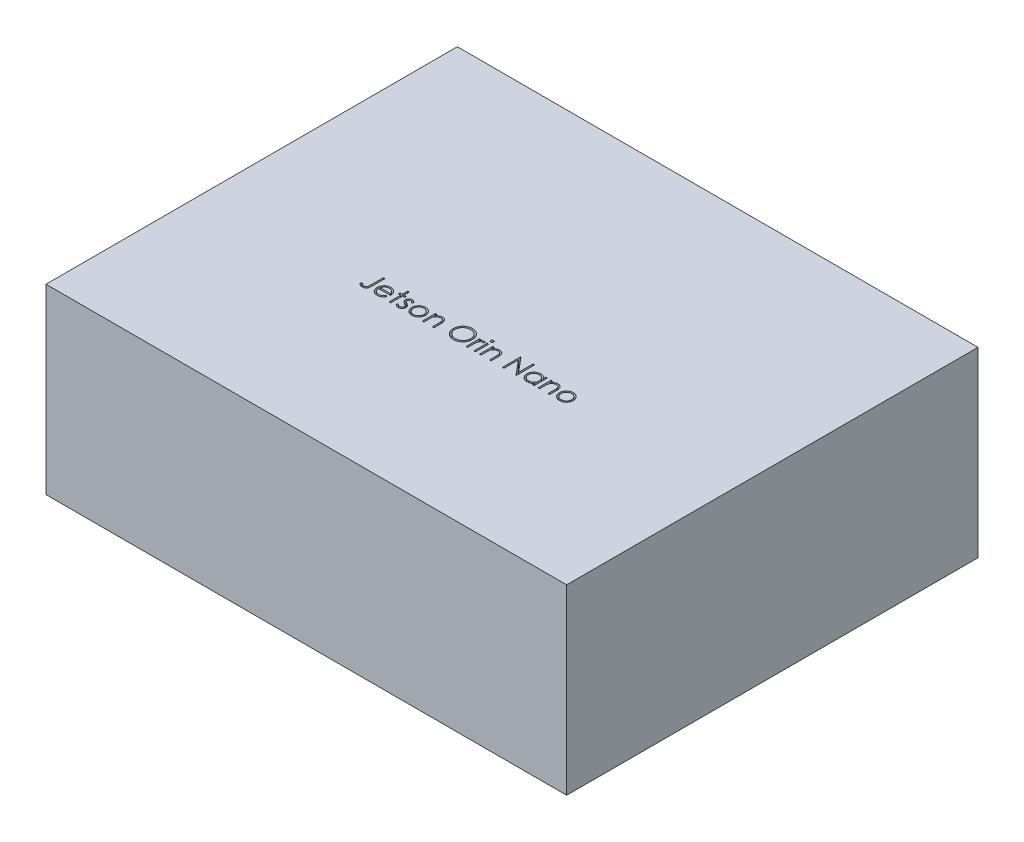
from build123d import *

# Parameters (mm, degrees)
SKETCH1_W           = 100
SKETCH1_H           = 79
BOSS_EXTRUDE1_DEPTH = 35
SKETCH2_W           = 0.314102564
SKETCH2_H           = 2.557692308
CUT_EXTRUDE1_DEPTH  = 5


with BuildPart() as part:
    # Sketch1 → Boss-Extrude1 (new body)
    with BuildSketch(Plane(origin=(0, 0, 0), x_dir=(1, 0, 0), z_dir=(0, 1, 0))):
        with Locations((50, 39.5)):
            Rectangle(SKETCH1_W, SKETCH1_H)
    extrude(amount=BOSS_EXTRUDE1_DEPTH)

    # Sketch2 → Cut-Extrude1 (cut)
    # profile 1 of 15: a face of its own
    with BuildSketch(Plane(origin=(0, 35, 0), x_dir=(1, 0, 0), z_dir=(0, 1, 0))):
        with BuildLine():
            Line((31.310897436, 33.5), (31.625, 33.5))
            Line((31.625, 33.5), (31.625, 31.136518429))
            add(Edge.make_bspline(
                [(31.625, 31.136518429), (31.624686081, 31.092813259), (31.624083319, 31.008893997), (31.620768909, 30.888020102), (31.614635431, 30.777649415), (31.605700418, 30.677530968), (31.593780186, 30.587978413), (31.580139157, 30.508299795), (31.563626359, 30.439160113), (31.538759892, 30.361524757), (31.497985944, 30.276380952), (31.436618906, 30.184425802), (31.360386109, 30.103992391), (31.272085076, 30.034139666), (31.170944052, 29.978482435), (31.059045833, 29.938527257), (30.937079245, 29.9141564), (30.852480033, 29.911582495), (30.808894231, 29.91025641)],
                knots=[0, 0, 0, 0, 1.237770943, 2.376671248, 3.424123796, 4.367912054, 5.222547132, 5.982086412, 6.656319012, 7.234008312, 8.288027371, 9.317870876, 10.352700517, 11.413286737, 12.494591526, 13.606319346, 14.766767577, 16, 16, 16, 16], degree=3))
            add(Edge.make_bspline(
                [(30.808894231, 29.91025641), (30.774935873, 29.911337019), (30.706609407, 29.913511277), (30.604918698, 29.93123299), (30.503516722, 29.958549033), (30.401865273, 29.998551628), (30.297956032, 30.052957227), (30.190381685, 30.124142043), (30.077758494, 30.21197357), (30.003575208, 30.279011315), (29.96474359, 30.314102564)],
                knots=[0, 0, 0, 0, 0.848567217, 1.707373443, 2.573483905, 3.470863513, 4.432650262, 5.500696352, 6.691726801, 8, 8, 8, 8], degree=3))
            Line((29.96474359, 30.314102564), (30.149839744, 30.583333333))
            add(Edge.make_bspline(
                [(30.149839744, 30.583333333), (30.192542423, 30.553885937), (30.273170649, 30.498285413), (30.39167509, 30.426758813), (30.496672243, 30.365433647), (30.56535519, 30.334181368), (30.597155449, 30.319711538)],
                knots=[0, 0, 0, 0, 1.196737151, 2.259595785, 3.194191475, 4, 4, 4, 4], degree=3))
            add(Edge.make_bspline(
                [(30.597155449, 30.319711538), (30.61643976, 30.312152081), (30.65426059, 30.297326302), (30.712085669, 30.280780404), (30.769580706, 30.271737994), (30.8076984, 30.270056661), (30.826422276, 30.269230769)],
                knots=[0, 0, 0, 0, 1.051806502, 2.062826769, 3.048436908, 4, 4, 4, 4], degree=3))
            add(Edge.make_bspline(
                [(30.826422276, 30.269230769), (30.850605064, 30.270253504), (30.89840552, 30.272275074), (30.967869514, 30.290124349), (31.034327546, 30.317368752), (31.095397203, 30.357260046), (31.15168259, 30.404691467), (31.198125416, 30.462047475), (31.23684266, 30.525613459), (31.260142354, 30.585784913), (31.274987126, 30.640661544), (31.284408753, 30.691094679), (31.292647413, 30.750056158), (31.299828965, 30.817616358), (31.304033435, 30.89391054), (31.308750708, 30.978714683), (31.310455969, 31.072242596), (31.31074579, 31.137453547), (31.310897436, 31.171574519)],
                knots=[0, 0, 0, 0, 0.997221856, 1.971139923, 2.944579524, 3.951425367, 4.971190333, 5.972282193, 6.985401279, 8.033996657, 8.624075553, 9.332086008, 10.151144245, 11.082816738, 12.137127781, 13.306538797, 14.590673636, 16, 16, 16, 16], degree=3))
            Line((31.310897436, 31.171574519), (31.310897436, 33.5))
        make_face()
    # profile 2 of 15: a face of its own
    with BuildSketch(Plane(origin=(0, 35, 0), x_dir=(1, 0, 0), z_dir=(0, 1, 0))):
        with BuildLine():
            Line((34.531850962, 30.807692308), (34.810897436, 30.661157853))
            add(Edge.make_bspline(
                [(34.810897436, 30.661157853), (34.788660841, 30.621714521), (34.745397232, 30.544973418), (34.670996484, 30.439541558), (34.593004412, 30.344693842), (34.507900444, 30.262964188), (34.418230765, 30.191712803), (34.32349811, 30.129374978), (34.223209292, 30.076256458), (34.117359567, 30.03150393), (34.005060016, 29.997094436), (33.8860385, 29.972790215), (33.760067005, 29.957766946), (33.673720825, 29.956021806), (33.629507212, 29.955128205)],
                knots=[0, 0, 0, 0, 1.120438281, 2.179929193, 3.190490725, 4.156257408, 5.095198341, 6.022838206, 6.959905092, 7.901321166, 8.864066838, 9.862729781, 10.905609505, 12, 12, 12, 12], degree=3))
            add(Edge.make_bspline(
                [(33.629507212, 29.955128205), (33.580365234, 29.95627538), (33.484503472, 29.958513187), (33.344963725, 29.977805652), (33.213584307, 30.00927801), (33.090372603, 30.053243552), (32.975630351, 30.110670876), (32.869129496, 30.180630358), (32.77030997, 30.262762612), (32.682285761, 30.357779056), (32.603041878, 30.459461013), (32.533116058, 30.565416898), (32.474658627, 30.675380122), (32.427106017, 30.788650646), (32.388701152, 30.90451454), (32.361934448, 31.024026007), (32.3465047, 31.146861592), (32.344140255, 31.229958927), (32.342948718, 31.271834936)],
                knots=[0, 0, 0, 0, 1.145258523, 2.234067595, 3.276747158, 4.290159414, 5.277019952, 6.260822364, 7.254936242, 8.264827045, 9.274100331, 10.257902744, 11.220704747, 12.172965371, 13.118907548, 14.062713208, 15.023725156, 16, 16, 16, 16], degree=3))
            add(Edge.make_bspline(
                [(32.342948718, 31.271834936), (32.344007859, 31.311129766), (32.346106938, 31.389006931), (32.359337725, 31.504272476), (32.382786018, 31.616300928), (32.414962342, 31.725185376), (32.456513588, 31.83074351), (32.507345807, 31.933039574), (32.567538185, 32.031964713), (32.614010859, 32.094367847), (32.637419872, 32.125801282)],
                knots=[0, 0, 0, 0, 1.024358464, 2.0301432, 3.019427413, 4.004406732, 4.986367066, 5.972626655, 6.978780325, 8, 8, 8, 8], degree=3))
            add(Edge.make_bspline(
                [(32.637419872, 32.125801282), (32.669127555, 32.163670152), (32.731538501, 32.238208303), (32.837094857, 32.336146628), (32.951395053, 32.418190404), (33.073006679, 32.48619754), (33.203343153, 32.537871187), (33.340652444, 32.576378769), (33.48649803, 32.59795678), (33.586203251, 32.601004614), (33.637219551, 32.602564103)],
                knots=[0, 0, 0, 0, 1.030682036, 2.02871468, 2.997146059, 3.962720338, 4.930598197, 5.918074684, 6.934738563, 8, 8, 8, 8], degree=3))
            add(Edge.make_bspline(
                [(33.637219551, 32.602564103), (33.689667157, 32.601210054), (33.792557403, 32.598553718), (33.942589524, 32.573927385), (34.08455024, 32.53487483), (34.218382744, 32.47972104), (34.344100605, 32.408561488), (34.460886655, 32.320419647), (34.570738167, 32.218001559), (34.634646746, 32.13923835), (34.667167468, 32.099158654)],
                knots=[0, 0, 0, 0, 1.056321875, 2.072262726, 3.055038591, 4.01806755, 4.982017516, 5.957941055, 6.960871419, 8, 8, 8, 8], degree=3))
            add(Edge.make_bspline(
                [(34.667167468, 32.099158654), (34.689294406, 32.068955072), (34.733400999, 32.008748954), (34.788648099, 31.910577797), (34.836605494, 31.807867202), (34.874938455, 31.698956905), (34.905977957, 31.585137325), (34.928434775, 31.46559478), (34.941604394, 31.340364869), (34.944193091, 31.255038314), (34.945512821, 31.211538462)],
                knots=[0, 0, 0, 0, 0.94817472, 1.890038105, 2.849395472, 3.817997239, 4.812318967, 5.836947057, 6.897266129, 8, 8, 8, 8], degree=3))
            Line((34.945512821, 31.211538462), (32.657051282, 31.211538462))
            add(Edge.make_bspline(
                [(32.657051282, 31.211538462), (32.658590888, 31.177837997), (32.661618462, 31.111567394), (32.675733606, 31.01459661), (32.697982379, 30.922223268), (32.729251442, 30.835140226), (32.767118287, 30.752210099), (32.813504004, 30.674048062), (32.868843558, 30.601010132), (32.930569257, 30.532442994), (32.999276353, 30.471382233), (33.0715591, 30.416730457), (33.148452665, 30.37092486), (33.229350748, 30.33374497), (33.314122534, 30.304638654), (33.402794729, 30.284770834), (33.495192845, 30.271463727), (33.558178579, 30.269984061), (33.590244391, 30.269230769)],
                knots=[0, 0, 0, 0, 1.094153842, 2.151609401, 3.174256925, 4.172055639, 5.149267565, 6.128595816, 7.11444997, 8.118368179, 9.117203808, 10.09244225, 11.054858984, 12.015122123, 12.976791628, 13.957293641, 14.960065497, 16, 16, 16, 16], degree=3))
            add(Edge.make_bspline(
                [(33.590244391, 30.269230769), (33.621595539, 30.269838826), (33.68380223, 30.271045327), (33.776443087, 30.282777238), (33.867582614, 30.301747513), (33.956843598, 30.327637504), (34.042414443, 30.359214356), (34.121659994, 30.397317213), (34.194540209, 30.43946696), (34.262657176, 30.487676635), (34.328728169, 30.546684822), (34.394270656, 30.620320543), (34.464547309, 30.707408071), (34.508536902, 30.772953737), (34.531850962, 30.807692308)],
                knots=[0, 0, 0, 0, 0.99110716, 1.966546729, 2.947904876, 3.932708344, 4.903319531, 5.828989031, 6.710028674, 7.56322171, 8.463672341, 9.504779593, 10.677557249, 12, 12, 12, 12], degree=3))
        make_face()
        with BuildLine():
            add(Edge.make_bspline(
                [(34.631410256, 31.525641026), (34.619913632, 31.567303899), (34.59778633, 31.64749152), (34.551549966, 31.75853241), (34.499478425, 31.857220311), (34.437856694, 31.942799944), (34.368037968, 32.018803457), (34.287392786, 32.085222043), (34.196956892, 32.144639494), (34.097197751, 32.194791993), (33.991555966, 32.237481852), (33.880949774, 32.266106968), (33.768091986, 32.28571651), (33.6917577, 32.287542618), (33.653345353, 32.288461538)],
                knots=[0, 0, 0, 0, 1.154881502, 2.222775134, 3.210006277, 4.132804581, 5.035138423, 5.962687519, 6.919655026, 7.923214229, 8.944639381, 9.960483929, 10.97369054, 12, 12, 12, 12], degree=3))
            add(Edge.make_bspline(
                [(33.653345353, 32.288461538), (33.621995914, 32.287849867), (33.560024665, 32.286640721), (33.468723597, 32.275170592), (33.381043898, 32.256210747), (33.29633861, 32.23024579), (33.215717742, 32.195637188), (33.137522974, 32.155053961), (33.063742577, 32.105512377), (33.017601282, 32.067753522), (32.994290865, 32.048677885)],
                knots=[0, 0, 0, 0, 1.04873581, 2.073130211, 3.073294108, 4.04793562, 5.032784715, 6.005352987, 6.992311501, 8, 8, 8, 8], degree=3))
            add(Edge.make_bspline(
                [(32.994290865, 32.048677885), (32.977597583, 32.033583569), (32.943814449, 32.003036353), (32.898673928, 31.950407146), (32.855453455, 31.893655584), (32.816119802, 31.83061046), (32.780042216, 31.761989681), (32.746282239, 31.688372045), (32.715895827, 31.609198915), (32.698799717, 31.554026476), (32.690004006, 31.525641026)],
                knots=[0, 0, 0, 0, 0.879870761, 1.780643979, 2.707998968, 3.669668524, 4.684282772, 5.740141944, 6.837334558, 8, 8, 8, 8], degree=3))
            Line((32.690004006, 31.525641026), (34.631410256, 31.525641026))
        make_face(mode=Mode.SUBTRACT)
    # profile 3 of 15: a face of its own
    with BuildSketch(Plane(origin=(0, 35, 0), x_dir=(1, 0, 0), z_dir=(0, 1, 0))):
        Polygon((35.887820513, 33.58974359), (36.201923077, 33.58974359), (36.201923077, 32.557692308), (36.650641026, 32.557692308), (36.650641026, 32.243589744), (36.201923077, 32.243589744), (36.201923077, 30), (35.887820513, 30), (35.887820513, 32.243589744), (35.439102564, 32.243589744), (35.439102564, 32.557692308), (35.887820513, 32.557692308), align=None)
    # profile 4 of 15: a face of its own
    with BuildSketch(Plane(origin=(0, 35, 0), x_dir=(1, 0, 0), z_dir=(0, 1, 0))):
        with BuildLine():
            Line((38.400641026, 32.238681891), (38.1875, 32.019230769))
            add(Edge.make_bspline(
                [(38.1875, 32.019230769), (38.169109496, 32.040543916), (38.133654771, 32.081633153), (38.07742329, 32.136570219), (38.021399686, 32.182707158), (37.966350873, 32.221659417), (37.910892603, 32.251108564), (37.855675685, 32.272603426), (37.800642947, 32.285905231), (37.763856912, 32.28761967), (37.745793269, 32.288461538)],
                knots=[0, 0, 0, 0, 1.26578478, 2.440284043, 3.530471711, 4.527705817, 5.468200915, 6.346673037, 7.188140097, 8, 8, 8, 8], degree=3))
            add(Edge.make_bspline(
                [(37.745793269, 32.288461538), (37.723653879, 32.287386665), (37.680086693, 32.285271468), (37.617660875, 32.264158037), (37.55971025, 32.231749299), (37.50955327, 32.185780715), (37.46706559, 32.133016446), (37.436051909, 32.074020122), (37.417085925, 32.010572078), (37.414681193, 31.96654222), (37.413461538, 31.944210737)],
                knots=[0, 0, 0, 0, 0.99966794, 1.967205029, 2.953328237, 3.988086729, 5.028030931, 6.008226631, 6.989793394, 8, 8, 8, 8], degree=3))
            add(Edge.make_bspline(
                [(37.413461538, 31.944210737), (37.414572351, 31.923998693), (37.416790844, 31.883631582), (37.434037523, 31.824083548), (37.461503595, 31.76602651), (37.48717379, 31.730463604), (37.500400641, 31.712139423)],
                knots=[0, 0, 0, 0, 0.960159726, 1.917612774, 2.927026955, 4, 4, 4, 4], degree=3))
            add(Edge.make_bspline(
                [(37.500400641, 31.712139423), (37.508364135, 31.702354839), (37.525313428, 31.681529584), (37.557121943, 31.652625731), (37.593144445, 31.62068348), (37.636464383, 31.588746643), (37.685215411, 31.555114918), (37.740454695, 31.521112785), (37.8004292, 31.48414836), (37.843366507, 31.460703924), (37.865685096, 31.448517628)],
                knots=[0, 0, 0, 0, 0.66740084, 1.420478572, 2.27185888, 3.217733974, 4.268547843, 5.408967954, 6.65319498, 8, 8, 8, 8], degree=3))
            add(Edge.make_bspline(
                [(37.865685096, 31.448517628), (37.892898673, 31.433272725), (37.945466343, 31.403824593), (38.020159111, 31.358114889), (38.087946152, 31.312683465), (38.149401819, 31.268016191), (38.203343628, 31.222863324), (38.251408181, 31.178955567), (38.292396625, 31.134966258), (38.315350551, 31.104233145), (38.326322115, 31.089543269)],
                knots=[0, 0, 0, 0, 1.27191281, 2.456916733, 3.569705269, 4.599008579, 5.553216877, 6.436649441, 7.252746552, 8, 8, 8, 8], degree=3))
            add(Edge.make_bspline(
                [(38.326322115, 31.089543269), (38.344532643, 31.059877181), (38.380774972, 31.00083616), (38.418833239, 30.903617733), (38.440893513, 30.80050723), (38.443955734, 30.72997501), (38.445512821, 30.694110577)],
                knots=[0, 0, 0, 0, 0.995354457, 1.980940102, 2.973342416, 4, 4, 4, 4], degree=3))
            add(Edge.make_bspline(
                [(38.445512821, 30.694110577), (38.444793287, 30.668841431), (38.443375367, 30.619045818), (38.4335173, 30.545710988), (38.416562323, 30.47557643), (38.393468569, 30.407881146), (38.362284197, 30.343922206), (38.325736399, 30.282085957), (38.281861488, 30.223710026), (38.231770112, 30.168871066), (38.176924618, 30.118785319), (38.11841848, 30.074761365), (38.056179649, 30.038187028), (37.990652848, 30.007921682), (37.921689194, 29.983853424), (37.849277904, 29.967190893), (37.77364915, 29.957218132), (37.722219342, 29.955833656), (37.696013622, 29.955128205)],
                knots=[0, 0, 0, 0, 1.032770009, 2.035186124, 3.017557409, 3.978232242, 4.952395191, 5.920591857, 6.910227898, 7.931268572, 8.952309245, 9.941945286, 10.918353717, 11.897095711, 12.887975737, 13.898235213, 14.929059601, 16, 16, 16, 16], degree=3))
            add(Edge.make_bspline(
                [(37.696013622, 29.955128205), (37.660646446, 29.956120905), (37.590403519, 29.958092513), (37.4865138, 29.976598574), (37.384993042, 30.005393968), (37.286609501, 30.045109902), (37.193563387, 30.095260615), (37.108432463, 30.155323008), (37.030921, 30.223313006), (36.986802727, 30.275425916), (36.96474359, 30.301482372)],
                knots=[0, 0, 0, 0, 1.013940152, 2.01379169, 3.017749504, 4.037548394, 5.051665909, 6.043208538, 7.021604269, 8, 8, 8, 8], degree=3))
            Line((36.96474359, 30.301482372), (37.172976763, 30.538461538))
            add(Edge.make_bspline(
                [(37.172976763, 30.538461538), (37.192749176, 30.517106774), (37.231080988, 30.475707334), (37.292382205, 30.420582993), (37.354761606, 30.374381722), (37.417596292, 30.335738307), (37.481816387, 30.305962904), (37.547062001, 30.28504431), (37.613200425, 30.271600118), (37.657622561, 30.270021836), (37.679887821, 30.269230769)],
                knots=[0, 0, 0, 0, 1.179806542, 2.287233372, 3.337373186, 4.324005949, 5.273901747, 6.200048787, 7.097828587, 8, 8, 8, 8], degree=3))
            add(Edge.make_bspline(
                [(37.679887821, 30.269230769), (37.710205746, 30.270601594), (37.769441888, 30.273279956), (37.854285647, 30.297597048), (37.932624273, 30.335727), (38.000647619, 30.389811698), (38.05854978, 30.452767271), (38.100477954, 30.52368139), (38.12675413, 30.600472847), (38.129840128, 30.653705149), (38.131410256, 30.680789263)],
                knots=[0, 0, 0, 0, 1.072336372, 2.095165389, 3.102688358, 4.141489647, 5.156069229, 6.117746104, 7.042326257, 8, 8, 8, 8], degree=3))
            add(Edge.make_bspline(
                [(38.131410256, 30.680789263), (38.130323962, 30.703098881), (38.128179219, 30.747146237), (38.111335947, 30.810896578), (38.084723095, 30.871365859), (38.058518447, 30.906755506), (38.045172276, 30.924779647)],
                knots=[0, 0, 0, 0, 1.013901739, 2.00181326, 2.98231254, 4, 4, 4, 4], degree=3))
            add(Edge.make_bspline(
                [(38.045172276, 30.924779647), (38.037149881, 30.93381501), (38.019674209, 30.953497292), (37.987618967, 30.98192237), (37.949237105, 31.01256047), (37.904096942, 31.044892059), (37.85210748, 31.078490664), (37.793058005, 31.113180016), (37.727757452, 31.150607742), (37.681586821, 31.175427397), (37.657451923, 31.188401442)],
                knots=[0, 0, 0, 0, 0.615000592, 1.339693406, 2.178160186, 3.116406724, 4.166410947, 5.330106347, 6.604359322, 8, 8, 8, 8], degree=3))
            add(Edge.make_bspline(
                [(37.657451923, 31.188401442), (37.631405283, 31.202940574), (37.580892536, 31.23113659), (37.509345245, 31.275052671), (37.44479789, 31.319719945), (37.385697316, 31.362632784), (37.33353631, 31.406053728), (37.288520362, 31.45003098), (37.248877146, 31.492790966), (37.226929734, 31.523088263), (37.216446314, 31.537560096)],
                knots=[0, 0, 0, 0, 1.262093308, 2.447601706, 3.550203992, 4.582594899, 5.537233252, 6.418365656, 7.244515135, 8, 8, 8, 8], degree=3))
            add(Edge.make_bspline(
                [(37.216446314, 31.537560096), (37.198315714, 31.566705711), (37.162048179, 31.625007126), (37.126832988, 31.722317603), (37.102626959, 31.824762661), (37.100464569, 31.895449515), (37.099358974, 31.931590545)],
                knots=[0, 0, 0, 0, 0.985009483, 1.970363186, 2.962279964, 4, 4, 4, 4], degree=3))
            add(Edge.make_bspline(
                [(37.099358974, 31.931590545), (37.09989317, 31.955215943), (37.100938666, 32.001454194), (37.109282717, 32.069393014), (37.124474428, 32.133941168), (37.143529351, 32.196068031), (37.170012355, 32.254570125), (37.201658261, 32.310227596), (37.238845685, 32.362963514), (37.281688976, 32.411966646), (37.328795622, 32.456475972), (37.379690391, 32.4952746), (37.433228648, 32.528380955), (37.489637067, 32.556146116), (37.54945754, 32.577147498), (37.612271927, 32.591604883), (37.677953082, 32.601260086), (37.722854208, 32.602123171), (37.745793269, 32.602564103)],
                knots=[0, 0, 0, 0, 1.087655834, 2.128696564, 3.144119009, 4.137814668, 5.115653402, 6.093965665, 7.082169637, 8.081268856, 9.086088321, 10.061021666, 11.022561449, 11.980240094, 12.950172527, 13.934149372, 14.944599409, 16, 16, 16, 16], degree=3))
            add(Edge.make_bspline(
                [(37.745793269, 32.602564103), (37.772985333, 32.601459762), (37.827879555, 32.599230364), (37.910234181, 32.581524674), (37.992467523, 32.552391569), (38.074790873, 32.512155336), (38.156601162, 32.46008846), (38.238618019, 32.397159161), (38.321826049, 32.323781446), (38.373782362, 32.267682221), (38.400641026, 32.238681891)],
                knots=[0, 0, 0, 0, 0.845714091, 1.707292901, 2.609013841, 3.555613372, 4.552488639, 5.621697636, 6.770543573, 8, 8, 8, 8], degree=3))
        make_face()
    # profile 5 of 15: a face of its own
    with BuildSketch(Plane(origin=(0, 35, 0), x_dir=(1, 0, 0), z_dir=(0, 1, 0))):
        with BuildLine():
            add(Edge.make_bspline(
                [(40.309094551, 32.602564103), (40.357085824, 32.601542211), (40.451184982, 32.599538533), (40.588992868, 32.578123567), (40.720538004, 32.545376203), (40.846324196, 32.500104641), (40.964740491, 32.43942269), (41.077511735, 32.367013399), (41.184328744, 32.281230805), (41.248351773, 32.214872737), (41.280849359, 32.181189904)],
                knots=[0, 0, 0, 0, 1.054011418, 2.066658804, 3.057071809, 4.030435133, 4.997543892, 5.974964718, 6.972108034, 8, 8, 8, 8], degree=3))
            add(Edge.make_bspline(
                [(41.280849359, 32.181189904), (41.308831313, 32.148975918), (41.364253693, 32.085171376), (41.435319412, 31.981715763), (41.496540972, 31.874575662), (41.545603933, 31.762328336), (41.584288957, 31.645953664), (41.611754653, 31.525051653), (41.628091588, 31.399889306), (41.630294555, 31.314885468), (41.631410256, 31.271834936)],
                knots=[0, 0, 0, 0, 1.025258237, 2.030674902, 3.01204498, 3.988269485, 4.97094183, 5.956517959, 6.965070386, 8, 8, 8, 8], degree=3))
            add(Edge.make_bspline(
                [(41.631410256, 31.271834936), (41.630428919, 31.228534878), (41.628489751, 31.142971945), (41.610146134, 31.016952579), (41.581615049, 30.894757756), (41.54078321, 30.776899063), (41.488425101, 30.663016235), (41.424534414, 30.553606686), (41.348662796, 30.448454553), (41.2626588, 30.348452714), (41.167606923, 30.2562865), (41.064490775, 30.17595823), (40.955336741, 30.107136706), (40.838693388, 30.05170029), (40.715625901, 30.00799059), (40.585868833, 29.977290573), (40.449623763, 29.95872889), (40.356596542, 29.956345316), (40.309094551, 29.955128205)],
                knots=[0, 0, 0, 0, 0.998656419, 1.973391657, 2.932242238, 3.890759089, 4.846373663, 5.82037756, 6.809684879, 7.83454468, 8.860553229, 9.859544525, 10.845671541, 11.83227036, 12.833544569, 13.85385346, 14.904124723, 16, 16, 16, 16], degree=3))
            add(Edge.make_bspline(
                [(40.309094551, 29.955128205), (40.261359832, 29.956349401), (40.167868972, 29.958741176), (40.03114299, 29.977218459), (39.901153371, 30.007976441), (39.777924773, 30.051843934), (39.660779926, 30.107138478), (39.550993429, 30.175750167), (39.447793513, 30.256310322), (39.352721529, 30.348446259), (39.266722924, 30.448456216), (39.190849915, 30.553606254), (39.126959589, 30.663016348), (39.074601385, 30.776899033), (39.033769572, 30.894757764), (39.00523848, 31.016952577), (38.986894865, 31.142971945), (38.984955696, 31.228534878), (38.983974359, 31.271834936)],
                knots=[0, 0, 0, 0, 1.099876186, 2.154163076, 3.173186993, 4.173200201, 5.163417411, 6.152872554, 7.150605724, 8.17532212, 9.198891216, 10.186952605, 11.159729845, 12.11414092, 13.071450619, 14.029093627, 15.002601286, 16, 16, 16, 16], degree=3))
            add(Edge.make_bspline(
                [(38.983974359, 31.271834936), (38.985097669, 31.314651482), (38.987321631, 31.399420884), (39.00364214, 31.524347945), (39.031000696, 31.645045334), (39.069732093, 31.76097081), (39.119247284, 31.872726246), (39.179608572, 31.980131077), (39.251399204, 32.083118877), (39.306601156, 32.146840957), (39.334535256, 32.179086538)],
                knots=[0, 0, 0, 0, 1.031353054, 2.041901799, 3.029428768, 4.008703097, 4.981709435, 5.96992636, 6.972712378, 8, 8, 8, 8], degree=3))
            add(Edge.make_bspline(
                [(39.334535256, 32.179086538), (39.366983847, 32.213061478), (39.430799711, 32.279879174), (39.538148439, 32.365411698), (39.65064226, 32.439327772), (39.770367186, 32.498803987), (39.896050044, 32.545642505), (40.028269287, 32.57820802), (40.166544802, 32.599461375), (40.261104423, 32.601519553), (40.309094551, 32.602564103)],
                knots=[0, 0, 0, 0, 1.027980169, 2.021703884, 2.998553061, 3.971491411, 4.943284454, 5.930300938, 6.949603206, 8, 8, 8, 8], degree=3))
        make_face()
        with BuildLine():
            add(Edge.make_bspline(
                [(40.307692308, 32.288461538), (40.273754696, 32.287496947), (40.206755568, 32.285592664), (40.108135983, 32.27110876), (40.013195829, 32.248161255), (39.921754985, 32.215557199), (39.834121813, 32.1734583), (39.75021241, 32.12174994), (39.66977997, 32.061116984), (39.594397907, 31.991654312), (39.525215595, 31.915775317), (39.464737618, 31.834926959), (39.413312512, 31.750420612), (39.370472353, 31.662168401), (39.338565165, 31.569275987), (39.315392142, 31.472795356), (39.300921902, 31.37252994), (39.299035523, 31.304368921), (39.298076923, 31.269731571)],
                knots=[0, 0, 0, 0, 1.021534396, 2.016698045, 2.994645724, 3.958388632, 4.93408049, 5.916473867, 6.921342795, 7.962252576, 8.998418191, 10.008913653, 10.997312074, 11.973003931, 12.956656626, 13.948281152, 14.957379055, 16, 16, 16, 16], degree=3))
            add(Edge.make_bspline(
                [(39.298076923, 31.269731571), (39.299683747, 31.224979543), (39.302872991, 31.136155138), (39.328808228, 31.005344015), (39.372194507, 30.879762163), (39.430781787, 30.760145777), (39.504188006, 30.649473499), (39.590675073, 30.550802015), (39.689314773, 30.465616203), (39.798931273, 30.394935358), (39.917285591, 30.338775602), (40.042541912, 30.298976626), (40.173182606, 30.273104934), (40.262463337, 30.270533459), (40.307692308, 30.269230769)],
                knots=[0, 0, 0, 0, 1.016792936, 2.018143844, 3.017858371, 4.030088057, 5.03801393, 6.028138512, 7.003788237, 7.991172063, 8.984598303, 9.972568034, 10.972917682, 12, 12, 12, 12], degree=3))
            add(Edge.make_bspline(
                [(40.307692308, 30.269230769), (40.352918677, 30.270541049), (40.442194273, 30.273127506), (40.572653449, 30.298846326), (40.697567421, 30.338949987), (40.815798809, 30.394872197), (40.925365412, 30.465884611), (41.024714534, 30.550320988), (41.110463145, 30.64973484), (41.18379675, 30.760292369), (41.243343492, 30.879576721), (41.286526694, 31.005367193), (41.31252428, 31.136149235), (41.315705109, 31.224977566), (41.317307692, 31.269731571)],
                knots=[0, 0, 0, 0, 1.02726834, 2.027799167, 3.010890988, 4.004497153, 4.992059811, 5.971914811, 6.958719428, 7.966827853, 8.981595046, 9.981490638, 10.983022906, 12, 12, 12, 12], degree=3))
            add(Edge.make_bspline(
                [(41.317307692, 31.269731571), (41.316349422, 31.304369128), (41.314463693, 31.372530554), (41.299988729, 31.472793007), (41.276833189, 31.569284604), (41.244861572, 31.662136607), (41.202207558, 31.750649112), (41.149790765, 31.834678839), (41.08955974, 31.916055385), (41.019542619, 31.991409026), (40.944239241, 32.061144062), (40.863774203, 32.121773452), (40.779989224, 32.173231047), (40.692610641, 32.215917288), (40.601158074, 32.247864628), (40.506350944, 32.271241259), (40.408152135, 32.285531456), (40.341393091, 32.287478598), (40.307692308, 32.288461538)],
                knots=[0, 0, 0, 0, 1.042956736, 2.052379634, 3.044323526, 4.02829302, 5.004299113, 5.996692471, 7.007513377, 8.048758398, 9.090003419, 10.095195979, 11.07790575, 12.047570684, 13.018257071, 13.989683339, 14.985167495, 16, 16, 16, 16], degree=3))
        make_face(mode=Mode.SUBTRACT)
    # profile 6 of 15: a face of its own
    with BuildSketch(Plane(origin=(0, 35, 0), x_dir=(1, 0, 0), z_dir=(0, 1, 0))):
        with BuildLine():
            Line((42.259615385, 32.557692308), (42.573717949, 32.557692308))
            Line((42.573717949, 32.557692308), (42.573717949, 32.096354167))
            add(Edge.make_bspline(
                [(42.573717949, 32.096354167), (42.607255584, 32.13819689), (42.672336535, 32.219394153), (42.780720868, 32.326114728), (42.895264768, 32.414059953), (43.015266772, 32.484163747), (43.140889782, 32.537010373), (43.271368052, 32.575176304), (43.407482758, 32.598061132), (43.500047195, 32.601051363), (43.546875, 32.602564103)],
                knots=[0, 0, 0, 0, 1.12780773, 2.188550248, 3.19190651, 4.159438251, 5.104880172, 6.052711206, 7.014878035, 8, 8, 8, 8], degree=3))
            add(Edge.make_bspline(
                [(43.546875, 32.602564103), (43.594205634, 32.600818907), (43.686843102, 32.597403139), (43.821721163, 32.570386448), (43.947694557, 32.524241192), (44.064314113, 32.461029122), (44.169441326, 32.382422649), (44.261766178, 32.290844867), (44.338129425, 32.185508784), (44.389326788, 32.087785627), (44.423052436, 32.001096833), (44.444284773, 31.926850083), (44.462315755, 31.844131932), (44.477947503, 31.753192343), (44.488524615, 31.653394153), (44.496866906, 31.545146461), (44.5028456, 31.42848433), (44.503082807, 31.347797703), (44.503205128, 31.306189904)],
                knots=[0, 0, 0, 0, 1.235846778, 2.418850247, 3.575807741, 4.728682307, 5.871620074, 6.994088408, 8.11269785, 9.256955736, 9.865816715, 10.540099792, 11.271859618, 12.076849838, 12.949306005, 13.892391288, 14.913166135, 16, 16, 16, 16], degree=3))
            Line((44.503205128, 31.306189904), (44.503205128, 30))
            Line((44.503205128, 30), (44.189102564, 30))
            Line((44.189102564, 30), (44.189102564, 31.203125))
            add(Edge.make_bspline(
                [(44.189102564, 31.203125), (44.188909356, 31.237947445), (44.188539782, 31.304556856), (44.187374135, 31.399925879), (44.184564329, 31.486412457), (44.180616016, 31.563809825), (44.174836985, 31.632043661), (44.168814354, 31.691252938), (44.161449377, 31.74136248), (44.154886464, 31.771527563), (44.151943109, 31.78505609)],
                knots=[0, 0, 0, 0, 1.430800155, 2.736877192, 3.918605307, 4.986035426, 5.920637409, 6.731861385, 7.431261377, 8, 8, 8, 8], degree=3))
            add(Edge.make_bspline(
                [(44.151943109, 31.78505609), (44.141317577, 31.824767275), (44.120866717, 31.901199019), (44.070332734, 32.004873372), (44.006518553, 32.09307156), (43.928620704, 32.165248281), (43.837391628, 32.221419118), (43.733084485, 32.260393073), (43.616705844, 32.284769342), (43.534851462, 32.287196474), (43.4921875, 32.288461538)],
                knots=[0, 0, 0, 0, 1.084156227, 2.086665306, 3.027808233, 3.945421172, 4.874247719, 5.839848303, 6.874090471, 8, 8, 8, 8], degree=3))
            add(Edge.make_bspline(
                [(43.4921875, 32.288461538), (43.466919816, 32.287985534), (43.416915723, 32.287043533), (43.342765751, 32.277592235), (43.270841578, 32.262133779), (43.200421369, 32.241265142), (43.132913576, 32.212602873), (43.066149284, 32.180073502), (43.00264252, 32.13952529), (42.941039123, 32.094334669), (42.883726315, 32.044255462), (42.830397977, 31.991410952), (42.782859957, 31.935135348), (42.739791282, 31.8763354), (42.702613018, 31.814203562), (42.67015993, 31.749339256), (42.642624235, 31.681657107), (42.628941543, 31.634682046), (42.622095353, 31.611177885)],
                knots=[0, 0, 0, 0, 1.023777757, 2.026029729, 3.023749952, 4.003683103, 4.997618607, 5.993177895, 7.010360494, 8.046726602, 9.087585522, 10.09234134, 11.086953743, 12.070360549, 13.043493632, 14.017870808, 15.008233677, 16, 16, 16, 16], degree=3))
            add(Edge.make_bspline(
                [(42.622095353, 31.611177885), (42.618155704, 31.593922682), (42.609579295, 31.556359007), (42.600316115, 31.494714588), (42.59190854, 31.423404613), (42.584871581, 31.342512296), (42.580566165, 31.251754421), (42.575871768, 31.151518583), (42.574162707, 31.041405094), (42.573870353, 30.964743402), (42.573717949, 30.924779647)],
                knots=[0, 0, 0, 0, 0.615963638, 1.340920617, 2.168419149, 3.115676021, 4.16674242, 5.331190069, 6.6087489, 8, 8, 8, 8], degree=3))
            Line((42.573717949, 30.924779647), (42.573717949, 30))
            Line((42.573717949, 30), (42.259615385, 30))
            Line((42.259615385, 30), (42.259615385, 32.557692308))
        make_face()
    # profile 7 of 15: a face of its own
    with BuildSketch(Plane(origin=(0, 35, 0), x_dir=(1, 0, 0), z_dir=(0, 1, 0))):
        with BuildLine():
            add(Edge.make_bspline(
                [(48.294871795, 33.58974359), (48.359679901, 33.58810211), (48.486968368, 33.584878109), (48.674043265, 33.560199006), (48.852638361, 33.517503616), (49.0242085, 33.460640633), (49.186701476, 33.384786248), (49.341340369, 33.2931011), (49.487757242, 33.184624641), (49.623978624, 33.060195414), (49.748635574, 32.92481196), (49.858461461, 32.78033405), (49.950503754, 32.627635248), (50.026089541, 32.467174417), (50.085388151, 32.299314449), (50.126307195, 32.123160446), (50.152445345, 31.939853756), (50.155501122, 31.814826892), (50.157051282, 31.751402244)],
                knots=[0, 0, 0, 0, 1.065120563, 2.091984664, 3.0946048, 4.079830382, 5.057816894, 6.036188127, 7.030412546, 8.04752943, 9.064399622, 10.05169764, 11.02544977, 11.989514704, 12.962713494, 13.945757189, 14.957906945, 16, 16, 16, 16], degree=3))
            add(Edge.make_bspline(
                [(50.157051282, 31.751402244), (50.15550135, 31.688444797), (50.152446253, 31.564348377), (50.126277475, 31.382204933), (50.085236475, 31.207114236), (50.026640209, 31.039368583), (49.951414731, 30.87879102), (49.85875956, 30.725804066), (49.749618349, 30.580357567), (49.625411498, 30.444044902), (49.490010456, 30.319047431), (49.344780189, 30.210128556), (49.192986869, 30.116404431), (49.032677161, 30.041620757), (48.865977124, 29.981848837), (48.691394801, 29.941096207), (48.509748247, 29.914809163), (48.385877243, 29.911790647), (48.322916667, 29.91025641)],
                knots=[0, 0, 0, 0, 1.043624062, 2.057103931, 3.04512605, 4.022047818, 4.998200453, 5.980619268, 6.982898556, 8.009068085, 9.034988726, 10.034168286, 11.015286542, 11.987931943, 12.962482838, 13.94673481, 14.956375938, 16, 16, 16, 16], degree=3))
            add(Edge.make_bspline(
                [(48.322916667, 29.91025641), (48.259492348, 29.911805797), (48.134466132, 29.914860051), (47.950929096, 29.941041456), (47.774651353, 29.98198276), (47.606137001, 30.040492196), (47.445292072, 30.116109427), (47.291801989, 30.208313806), (47.146282842, 30.317720947), (47.009941095, 30.441887521), (46.885191897, 30.577059073), (46.776432521, 30.721893329), (46.684207408, 30.873548785), (46.608844076, 31.032446309), (46.549179616, 31.197817752), (46.508474798, 31.370766229), (46.482138846, 31.550305735), (46.479104, 31.672548634), (46.477564103, 31.734575321)],
                knots=[0, 0, 0, 0, 1.053102029, 2.075944431, 3.073151272, 4.055350789, 5.033113405, 6.020478099, 7.024410459, 8.052272461, 9.079885166, 10.07527673, 11.055994387, 12.023226415, 12.992069828, 13.970394897, 14.97016774, 16, 16, 16, 16], degree=3))
            add(Edge.make_bspline(
                [(46.477564103, 31.734575321), (46.478098738, 31.77620799), (46.479161264, 31.858948113), (46.491952957, 31.981814713), (46.510514658, 32.102705371), (46.537116571, 32.221276319), (46.571908238, 32.337237304), (46.612960265, 32.451388067), (46.66310011, 32.56257179), (46.719780758, 32.671315182), (46.783042566, 32.775923088), (46.852918316, 32.874802671), (46.926953684, 32.968783668), (47.008117078, 33.055430672), (47.093733523, 33.137264328), (47.185191901, 33.213027045), (47.281934146, 33.283401996), (47.384376525, 33.346822337), (47.4899948, 33.404181472), (47.598871578, 33.453403323), (47.70952815, 33.495649384), (47.822482798, 33.529890209), (47.93743557, 33.556922245), (48.054637354, 33.575329599), (48.17399478, 33.588153917), (48.254406099, 33.589211419), (48.294871795, 33.58974359)],
                knots=[0, 0, 0, 0, 1.037015668, 2.060948919, 3.074880161, 4.083647147, 5.086022904, 6.090072063, 7.104153813, 8.122640571, 9.144368836, 10.147691507, 11.138137339, 12.123020368, 13.103399296, 14.087645067, 15.080126199, 16.082011238, 17.087798457, 18.072939717, 19.057185487, 20.037253025, 21.01195951, 21.997135196, 22.992090687, 24, 24, 24, 24], degree=3))
        make_face()
        with BuildLine():
            add(Edge.make_bspline(
                [(48.310296474, 33.230769231), (48.277081841, 33.230364341), (48.210970108, 33.229558431), (48.112685572, 33.218942715), (48.015693638, 33.203812826), (47.919974276, 33.182231305), (47.825927986, 33.152827253), (47.732678145, 33.118986345), (47.641075091, 33.077765254), (47.551421233, 33.03119255), (47.464506158, 32.979643629), (47.382493457, 32.922671862), (47.305170813, 32.861613307), (47.232727546, 32.79632547), (47.165376374, 32.726475868), (47.101791673, 32.653123432), (47.044522091, 32.574171541), (46.992036514, 32.491761134), (46.945068674, 32.405999553), (46.903303319, 32.317789691), (46.86913931, 32.226412004), (46.841276934, 32.132857846), (46.818177123, 32.037275387), (46.803543199, 31.938939538), (46.79281084, 31.838344426), (46.792050994, 31.770362572), (46.791666667, 31.735977564)],
                knots=[0, 0, 0, 0, 1.008559885, 2.007477868, 2.99961109, 3.989939068, 4.984837346, 5.991145699, 7.001802488, 8.033829008, 9.059044045, 10.069351652, 11.065060232, 12.050310815, 13.029377138, 14.011219647, 14.996725999, 15.989392538, 16.977580475, 17.965360261, 18.951710183, 19.937753436, 20.929683414, 21.935841486, 22.955955122, 24, 24, 24, 24], degree=3))
            add(Edge.make_bspline(
                [(46.791666667, 31.735977564), (46.792941529, 31.685415343), (46.795449576, 31.585943813), (46.817407147, 31.440175669), (46.851229121, 31.300087383), (46.901086487, 31.166445474), (46.963437102, 31.038101191), (47.040463992, 30.916193086), (47.131723078, 30.800688212), (47.235386605, 30.692392943), (47.348709311, 30.593547138), (47.469042041, 30.50678373), (47.595095649, 30.43337348), (47.727198851, 30.373568408), (47.86464639, 30.32617867), (48.008323941, 30.293700039), (48.157274401, 30.272324583), (48.258805056, 30.270271827), (48.310296474, 30.269230769)],
                knots=[0, 0, 0, 0, 1.032063989, 2.030389145, 3.003944642, 3.970395727, 4.937377036, 5.913328081, 6.909231446, 7.93887556, 8.970685674, 9.976071282, 10.964166581, 11.944589148, 12.933237628, 13.927779006, 14.949070134, 16, 16, 16, 16], degree=3))
            add(Edge.make_bspline(
                [(48.310296474, 30.269230769), (48.344905976, 30.269706274), (48.413547012, 30.270649342), (48.515642535, 30.280148018), (48.615898746, 30.295379888), (48.714175026, 30.317310543), (48.810359838, 30.34475775), (48.904854641, 30.377365478), (48.996652931, 30.418046682), (49.086912769, 30.462994633), (49.173309011, 30.514234791), (49.255784543, 30.56927294), (49.332260523, 30.630241561), (49.404649594, 30.694559374), (49.472277283, 30.763523221), (49.534686267, 30.837043443), (49.5916664, 30.9155841), (49.644132046, 30.997869506), (49.690935309, 31.083865759), (49.731714408, 31.172395437), (49.766310524, 31.263240546), (49.794239029, 31.356532118), (49.81612449, 31.452092966), (49.83120441, 31.550051045), (49.841752849, 31.650210387), (49.842547926, 31.717954243), (49.842948718, 31.752103365)],
                knots=[0, 0, 0, 0, 1.047197238, 2.076906641, 3.100256066, 4.114471768, 5.12198147, 6.126382909, 7.136867548, 8.15857795, 9.17633901, 10.174870724, 11.156907918, 12.133735059, 13.104061851, 14.077631395, 15.04955518, 16.038496417, 17.029181396, 18.010275684, 18.986308667, 19.968651475, 20.955262928, 21.950658345, 22.966943676, 24, 24, 24, 24], degree=3))
            add(Edge.make_bspline(
                [(49.842948718, 31.752103365), (49.842547605, 31.78601887), (49.841751923, 31.85329652), (49.831209449, 31.952757338), (49.816108558, 32.05001055), (49.79434585, 32.144674353), (49.766295697, 32.236772878), (49.731708366, 32.326219625), (49.690923067, 32.413347821), (49.644114842, 32.497942118), (49.591499019, 32.579116855), (49.534004776, 32.656719268), (49.470639428, 32.729292009), (49.403213403, 32.798626703), (49.330042517, 32.863244593), (49.251458223, 32.923167114), (49.168414546, 32.979840388), (49.08048731, 33.03096595), (48.989743356, 33.078180182), (48.896629398, 33.118631186), (48.802200299, 33.153003305), (48.706696186, 33.18232027), (48.609313208, 33.2037283), (48.510709379, 33.21895635), (48.411021121, 33.229554736), (48.343977901, 33.230363114), (48.310296474, 33.230769231)],
                knots=[0, 0, 0, 0, 1.02996197, 2.043119294, 3.035359645, 4.018872909, 4.991431989, 5.957985074, 6.929999688, 7.912076566, 8.892894881, 9.867085534, 10.843653904, 11.817741046, 12.803660682, 13.806313499, 14.818574707, 15.856120519, 16.894564902, 17.924820532, 18.937903209, 19.946497019, 20.957711757, 21.963978472, 22.977135795, 24, 24, 24, 24], degree=3))
        make_face(mode=Mode.SUBTRACT)
    # profile 8 of 15: a face of its own
    with BuildSketch(Plane(origin=(0, 35, 0), x_dir=(1, 0, 0), z_dir=(0, 1, 0))):
        with BuildLine():
            Line((50.695512821, 32.557692308), (51.009615385, 32.557692308))
            Line((51.009615385, 32.557692308), (51.009615385, 32.181189904))
            add(Edge.make_bspline(
                [(51.009615385, 32.181189904), (51.032804143, 32.216245732), (51.077152464, 32.283289731), (51.150865394, 32.371959032), (51.226368725, 32.445374079), (51.304023912, 32.503877598), (51.384402012, 32.547690717), (51.465738964, 32.579783752), (51.549314434, 32.598761067), (51.605476358, 32.601294726), (51.633613782, 32.602564103)],
                knots=[0, 0, 0, 0, 1.2804753, 2.448899062, 3.506932113, 4.484331642, 5.4025378, 6.288909075, 7.142734305, 8, 8, 8, 8], degree=3))
            add(Edge.make_bspline(
                [(51.633613782, 32.602564103), (51.655440109, 32.601373576), (51.700349194, 32.59892399), (51.768331784, 32.581713165), (51.838375235, 32.554235143), (51.883517623, 32.52839492), (51.907051282, 32.514923878)],
                knots=[0, 0, 0, 0, 0.901110191, 1.854092781, 2.881294221, 4, 4, 4, 4], degree=3))
            Line((51.907051282, 32.514923878), (51.734575321, 32.242888622))
            add(Edge.make_bspline(
                [(51.734575321, 32.242888622), (51.719466299, 32.249628888), (51.690786485, 32.262423203), (51.648831919, 32.277565213), (51.610150582, 32.286481129), (51.585507023, 32.287831847), (51.574018429, 32.288461538)],
                knots=[0, 0, 0, 0, 1.180555205, 2.24091978, 3.179933427, 4, 4, 4, 4], degree=3))
            add(Edge.make_bspline(
                [(51.574018429, 32.288461538), (51.548812696, 32.286781501), (51.497400306, 32.283354712), (51.421915807, 32.256415904), (51.348668601, 32.212890664), (51.290496939, 32.164619552), (51.245454686, 32.118071755), (51.21331446, 32.077423352), (51.183831713, 32.031844721), (51.155661493, 31.982115037), (51.129995199, 31.927385191), (51.10604053, 31.868201977), (51.084381667, 31.804496849), (51.072031422, 31.760114328), (51.065705128, 31.737379808)],
                knots=[0, 0, 0, 0, 1.125678352, 2.296057538, 3.5422874, 4.923748041, 5.663163013, 6.437101912, 7.23742474, 8.08941207, 8.991984279, 9.93940061, 10.944477711, 12, 12, 12, 12], degree=3))
            add(Edge.make_bspline(
                [(51.065705128, 31.737379808), (51.060972735, 31.717102634), (51.050490843, 31.672190235), (51.040299305, 31.596841711), (51.030229787, 31.507818052), (51.023133169, 31.404871459), (51.016555127, 31.288259015), (51.012845045, 31.15780307), (51.009741904, 31.013369718), (51.009658837, 30.912395365), (51.009615385, 30.859575321)],
                knots=[0, 0, 0, 0, 0.566838948, 1.255505196, 2.06880316, 3.007127437, 4.065329342, 5.249902469, 6.561414163, 8, 8, 8, 8], degree=3))
            Line((51.009615385, 30.859575321), (51.009615385, 30))
            Line((51.009615385, 30), (50.695512821, 30))
            Line((50.695512821, 30), (50.695512821, 32.557692308))
        make_face()
    # profile 9 of 15: a face of its own
    with BuildSketch(Plane(origin=(0, 35, 0), x_dir=(1, 0, 0), z_dir=(0, 1, 0))):
        with BuildLine():
            add(Edge.make_bspline(
                [(52.33193109, 33.634615385), (52.351422406, 33.633711232), (52.389590145, 33.631940728), (52.444783413, 33.616779251), (52.495040425, 33.591079566), (52.539618158, 33.556599885), (52.577870045, 33.516050441), (52.604650755, 33.468789473), (52.621863151, 33.417730834), (52.623941706, 33.382115745), (52.625, 33.363982372)],
                knots=[0, 0, 0, 0, 1.055194115, 2.066272739, 3.074728998, 4.095836921, 5.109056067, 6.073838105, 7.019297344, 8, 8, 8, 8], degree=3))
            add(Edge.make_bspline(
                [(52.625, 33.363982372), (52.62391784, 33.346319719), (52.621778538, 33.311402744), (52.60466405, 33.261229272), (52.577641812, 33.214624988), (52.539642687, 33.174154278), (52.495033926, 33.139693658), (52.44478514, 33.113988919), (52.389589691, 33.098828782), (52.351422252, 33.097058093), (52.33193109, 33.096153846)],
                knots=[0, 0, 0, 0, 0.96129708, 1.900370562, 2.859976407, 3.87933698, 4.906634145, 5.921202961, 6.938410037, 8, 8, 8, 8], degree=3))
            add(Edge.make_bspline(
                [(52.33193109, 33.096153846), (52.312662815, 33.097023566), (52.275159634, 33.098716363), (52.220792792, 33.114286381), (52.170964303, 33.139702454), (52.12629963, 33.173928639), (52.089069437, 33.214873536), (52.061971111, 33.26120083), (52.04489615, 33.311409985), (52.042751521, 33.346322151), (52.041666667, 33.363982372)],
                knots=[0, 0, 0, 0, 1.054934014, 2.053291228, 3.073705704, 4.106921865, 5.123545215, 6.088680038, 7.033164197, 8, 8, 8, 8], degree=3))
            add(Edge.make_bspline(
                [(52.041666667, 33.363982372), (52.042727753, 33.382113221), (52.044811794, 33.417723354), (52.06198391, 33.468818387), (52.088843718, 33.515799889), (52.126324282, 33.556825388), (52.170957742, 33.591070823), (52.220794487, 33.616481804), (52.275159187, 33.632053144), (52.312662663, 33.633745758), (52.33193109, 33.634615385)],
                knots=[0, 0, 0, 0, 0.98631895, 1.937192651, 2.907499808, 3.917963147, 4.944918757, 5.95915025, 6.951458133, 8, 8, 8, 8], degree=3))
        make_face()
    # profile 10 of 15: a face of its own
    with BuildSketch(Plane(origin=(0, 35, 0), x_dir=(1, 0, 0), z_dir=(0, 1, 0))):
        with Locations((52.333333333, 31.278846154)):
            Rectangle(SKETCH2_W, SKETCH2_H)
    # profile 11 of 15: a face of its own
    with BuildSketch(Plane(origin=(0, 35, 0), x_dir=(1, 0, 0), z_dir=(0, 1, 0))):
        with BuildLine():
            Line((53.253205128, 32.557692308), (53.567307692, 32.557692308))
            Line((53.567307692, 32.557692308), (53.567307692, 32.096354167))
            add(Edge.make_bspline(
                [(53.567307692, 32.096354167), (53.600845327, 32.13819689), (53.665926278, 32.219394153), (53.774310612, 32.326114728), (53.888854512, 32.414059953), (54.008856516, 32.484163747), (54.134479526, 32.537010373), (54.264957796, 32.575176304), (54.401072502, 32.598061132), (54.493636939, 32.601051363), (54.540464744, 32.602564103)],
                knots=[0, 0, 0, 0, 1.12780773, 2.188550248, 3.19190651, 4.159438251, 5.104880172, 6.052711206, 7.014878035, 8, 8, 8, 8], degree=3))
            add(Edge.make_bspline(
                [(54.540464744, 32.602564103), (54.587795378, 32.600818907), (54.680432845, 32.597403139), (54.815310907, 32.570386448), (54.941284301, 32.524241192), (55.057903856, 32.461029122), (55.16303107, 32.382422649), (55.255355921, 32.290844867), (55.331719169, 32.185508784), (55.382916532, 32.087785627), (55.416642179, 32.001096833), (55.437874517, 31.926850083), (55.455905498, 31.844131932), (55.471537246, 31.753192343), (55.482114358, 31.653394153), (55.49045665, 31.545146461), (55.496435344, 31.42848433), (55.496672551, 31.347797703), (55.496794872, 31.306189904)],
                knots=[0, 0, 0, 0, 1.235846778, 2.418850247, 3.575807741, 4.728682307, 5.871620074, 6.994088408, 8.11269785, 9.256955736, 9.865816715, 10.540099792, 11.271859618, 12.076849838, 12.949306005, 13.892391288, 14.913166135, 16, 16, 16, 16], degree=3))
            Line((55.496794872, 31.306189904), (55.496794872, 30))
            Line((55.496794872, 30), (55.182692308, 30))
            Line((55.182692308, 30), (55.182692308, 31.203125))
            add(Edge.make_bspline(
                [(55.182692308, 31.203125), (55.1824991, 31.237947445), (55.182129526, 31.304556856), (55.180963879, 31.399925879), (55.178154072, 31.486412457), (55.174205759, 31.563809825), (55.168426729, 31.632043661), (55.162404098, 31.691252938), (55.155039121, 31.74136248), (55.148476208, 31.771527563), (55.145532853, 31.78505609)],
                knots=[0, 0, 0, 0, 1.430800155, 2.736877192, 3.918605307, 4.986035426, 5.920637409, 6.731861385, 7.431261377, 8, 8, 8, 8], degree=3))
            add(Edge.make_bspline(
                [(55.145532853, 31.78505609), (55.134907321, 31.824767275), (55.11445646, 31.901199019), (55.063922477, 32.004873372), (55.000108296, 32.09307156), (54.922210447, 32.165248281), (54.830981371, 32.221419118), (54.726674229, 32.260393073), (54.610295588, 32.284769342), (54.528441205, 32.287196474), (54.485777244, 32.288461538)],
                knots=[0, 0, 0, 0, 1.084156227, 2.086665306, 3.027808233, 3.945421172, 4.874247719, 5.839848303, 6.874090471, 8, 8, 8, 8], degree=3))
            add(Edge.make_bspline(
                [(54.485777244, 32.288461538), (54.46050956, 32.287985534), (54.410505467, 32.287043533), (54.336355495, 32.277592235), (54.264431322, 32.262133779), (54.194011113, 32.241265142), (54.126503319, 32.212602873), (54.059739028, 32.180073502), (53.996232264, 32.13952529), (53.934628867, 32.094334669), (53.877316059, 32.044255462), (53.823987721, 31.991410952), (53.7764497, 31.935135348), (53.733381025, 31.8763354), (53.696202762, 31.814203562), (53.663749674, 31.749339256), (53.636213979, 31.681657107), (53.622531286, 31.634682046), (53.615685096, 31.611177885)],
                knots=[0, 0, 0, 0, 1.023777757, 2.026029729, 3.023749952, 4.003683103, 4.997618607, 5.993177895, 7.010360494, 8.046726602, 9.087585522, 10.09234134, 11.086953743, 12.070360549, 13.043493632, 14.017870808, 15.008233677, 16, 16, 16, 16], degree=3))
            add(Edge.make_bspline(
                [(53.615685096, 31.611177885), (53.611745448, 31.593922682), (53.603169039, 31.556359007), (53.593905859, 31.494714588), (53.585498283, 31.423404613), (53.578461325, 31.342512296), (53.574155908, 31.251754421), (53.569461512, 31.151518583), (53.567752451, 31.041405094), (53.567460097, 30.964743402), (53.567307692, 30.924779647)],
                knots=[0, 0, 0, 0, 0.615963638, 1.340920617, 2.168419149, 3.115676021, 4.16674242, 5.331190069, 6.6087489, 8, 8, 8, 8], degree=3))
            Line((53.567307692, 30.924779647), (53.567307692, 30))
            Line((53.567307692, 30), (53.253205128, 30))
            Line((53.253205128, 30), (53.253205128, 32.557692308))
        make_face()
    # profile 12 of 15: a face of its own
    with BuildSketch(Plane(origin=(0, 35, 0), x_dir=(1, 0, 0), z_dir=(0, 1, 0))):
        Polygon((57.650641026, 30), (57.650641026, 33.5), (57.716546474, 33.5), (60.028846154, 30.745292468), (60.028846154, 33.5), (60.342948718, 33.5), (60.342948718, 30), (60.271434295, 30), (57.96474359, 32.748397436), (57.96474359, 30), align=None)
    # profile 13 of 15: a face of its own
    with BuildSketch(Plane(origin=(0, 35, 0), x_dir=(1, 0, 0), z_dir=(0, 1, 0))):
        with BuildLine():
            Line((63.753205128, 32.557692308), (63.753205128, 30))
            Line((63.753205128, 30), (63.439102564, 30))
            Line((63.439102564, 30), (63.439102564, 30.442407853))
            add(Edge.make_bspline(
                [(63.439102564, 30.442407853), (63.403683773, 30.402368259), (63.334563558, 30.324230488), (63.21912244, 30.222148315), (63.096754262, 30.137769993), (62.968052941, 30.069620078), (62.833134698, 30.018428021), (62.692298611, 29.982041862), (62.54548723, 29.958648027), (62.445234875, 29.956312005), (62.39443109, 29.955128205)],
                knots=[0, 0, 0, 0, 1.074387032, 2.096679803, 3.090159297, 4.057316773, 5.018401886, 5.985159533, 6.978961417, 8, 8, 8, 8], degree=3))
            add(Edge.make_bspline(
                [(62.39443109, 29.955128205), (62.349263136, 29.956354577), (62.260189931, 29.958773038), (62.129160854, 29.977535341), (62.003068604, 30.007665963), (61.881794032, 30.049566853), (61.766121886, 30.105147674), (61.65506179, 30.171688922), (61.549189098, 30.250929752), (61.450117559, 30.341517781), (61.358885558, 30.439912768), (61.278824286, 30.544858315), (61.212071206, 30.655900619), (61.156251125, 30.771633773), (61.113254781, 30.892948692), (61.083281146, 31.01942586), (61.0645407, 31.150915734), (61.062123239, 31.240455257), (61.060897436, 31.285857372)],
                knots=[0, 0, 0, 0, 1.033919861, 2.038935746, 3.024066025, 3.998881131, 4.97069526, 5.957263378, 6.95902576, 7.993208707, 9.027059324, 10.027763471, 11.009749337, 11.988697705, 12.965288445, 13.950418724, 14.960734635, 16, 16, 16, 16], degree=3))
            add(Edge.make_bspline(
                [(61.060897436, 31.285857372), (61.062150407, 31.330321075), (61.064627464, 31.418223419), (61.083080684, 31.547502117), (61.114111693, 31.672020377), (61.15765954, 31.791377321), (61.213501495, 31.905717371), (61.281429582, 32.015121396), (61.361448707, 32.119890793), (61.453701114, 32.21756202), (61.553635884, 32.307782634), (61.660544615, 32.38619168), (61.771767896, 32.453908529), (61.889030907, 32.507562005), (62.010598012, 32.550971109), (62.137551457, 32.581004078), (62.269363036, 32.598701399), (62.358853528, 32.601264163), (62.404246795, 32.602564103)],
                knots=[0, 0, 0, 0, 1.020392517, 2.01726096, 2.990465484, 3.961182959, 4.928053699, 5.906110375, 6.912531644, 7.948652711, 8.985773172, 9.998621852, 10.987621588, 11.969261332, 12.953316658, 13.946091881, 14.958173133, 16, 16, 16, 16], degree=3))
            add(Edge.make_bspline(
                [(62.404246795, 32.602564103), (62.456446654, 32.601126351), (62.558808114, 32.598306988), (62.708536123, 32.574844261), (62.850180601, 32.535205794), (62.984834953, 32.481288296), (63.112015639, 32.409639567), (63.230518624, 32.319259606), (63.341584107, 32.210718419), (63.405964398, 32.127347974), (63.439102564, 32.084435096)],
                knots=[0, 0, 0, 0, 1.038897134, 2.037228247, 3.008116434, 3.962042015, 4.918381754, 5.904844433, 6.921570401, 8, 8, 8, 8], degree=3))
            Line((63.439102564, 32.084435096), (63.439102564, 32.557692308))
            Line((63.439102564, 32.557692308), (63.753205128, 32.557692308))
        make_face()
        with BuildLine():
            add(Edge.make_bspline(
                [(62.408453526, 32.288461538), (62.362539188, 32.286827901), (62.271911588, 32.28360336), (62.138867586, 32.258429865), (62.011554172, 32.21654527), (61.890608097, 32.159263369), (61.777939881, 32.087234632), (61.67724621, 32.000113249), (61.587703509, 31.900276235), (61.512395244, 31.788174125), (61.451004747, 31.667996033), (61.407837715, 31.542371595), (61.379368468, 31.413566618), (61.376459948, 31.326203932), (61.375, 31.282351763)],
                knots=[0, 0, 0, 0, 1.031046209, 2.035121221, 3.029706178, 4.034933723, 5.034054252, 6.02443088, 7.017295772, 8.038157696, 9.050218397, 10.03989886, 11.016116709, 12, 12, 12, 12], degree=3))
            add(Edge.make_bspline(
                [(61.375, 31.282351763), (61.376864893, 31.238761656), (61.38058737, 31.1517523), (61.407338065, 31.022771723), (61.452217938, 30.897117681), (61.513460001, 30.775856687), (61.590146625, 30.663272587), (61.679035278, 30.561532464), (61.780985559, 30.474042876), (61.893913066, 30.400805303), (62.014521037, 30.341642782), (62.141354968, 30.300477142), (62.272030606, 30.273899362), (62.36088294, 30.270794885), (62.405649038, 30.269230769)],
                knots=[0, 0, 0, 0, 0.979072187, 1.954306742, 2.945804271, 3.96968567, 4.997920485, 5.998718438, 6.996577872, 8.005894225, 9.015743152, 10.005417472, 10.995077863, 12, 12, 12, 12], degree=3))
            add(Edge.make_bspline(
                [(62.405649038, 30.269230769), (62.451095541, 30.270890733), (62.541484128, 30.274192237), (62.674922836, 30.299473502), (62.804417798, 30.3412423), (62.928205027, 30.399141427), (63.043521158, 30.470898783), (63.147019036, 30.554905874), (63.234535004, 30.652609058), (63.308727614, 30.759985511), (63.36690303, 30.877697508), (63.409279089, 31.003031698), (63.434332995, 31.135992447), (63.437490725, 31.226856374), (63.439102564, 31.273237179)],
                knots=[0, 0, 0, 0, 1.01762866, 2.023962475, 3.030623092, 4.058876274, 5.077231937, 6.066672613, 7.034107872, 8.005628644, 8.981990164, 9.965428785, 10.961468474, 12, 12, 12, 12], degree=3))
            add(Edge.make_bspline(
                [(63.439102564, 31.273237179), (63.438142908, 31.30857501), (63.436254, 31.378131043), (63.421823431, 31.480258561), (63.398868504, 31.577992287), (63.366522334, 31.671434976), (63.32403105, 31.760069991), (63.272783284, 31.844533752), (63.211877834, 31.924386963), (63.142295138, 31.998530034), (63.066129936, 32.066156496), (62.985535395, 32.126520737), (62.899556648, 32.17610951), (62.809639611, 32.217150781), (62.715628277, 32.249809931), (62.616757657, 32.271597625), (62.51407867, 32.286557946), (62.444032615, 32.287820327), (62.408453526, 32.288461538)],
                knots=[0, 0, 0, 0, 1.050140795, 2.067009409, 3.05949893, 4.030605086, 5.00011959, 5.97591094, 6.962425594, 7.979863591, 8.993523472, 9.986985069, 10.967611495, 11.937549037, 12.921786183, 13.919465291, 14.943216303, 16, 16, 16, 16], degree=3))
        make_face(mode=Mode.SUBTRACT)
    # profile 14 of 15: a face of its own
    with BuildSketch(Plane(origin=(0, 35, 0), x_dir=(1, 0, 0), z_dir=(0, 1, 0))):
        with BuildLine():
            Line((64.471153846, 32.557692308), (64.78525641, 32.557692308))
            Line((64.78525641, 32.557692308), (64.78525641, 32.096354167))
            add(Edge.make_bspline(
                [(64.78525641, 32.096354167), (64.818794045, 32.13819689), (64.883874996, 32.219394153), (64.99225933, 32.326114728), (65.10680323, 32.414059953), (65.226805234, 32.484163747), (65.352428244, 32.537010373), (65.482906514, 32.575176304), (65.61902122, 32.598061132), (65.711585657, 32.601051363), (65.758413462, 32.602564103)],
                knots=[0, 0, 0, 0, 1.12780773, 2.188550248, 3.19190651, 4.159438251, 5.104880172, 6.052711206, 7.014878035, 8, 8, 8, 8], degree=3))
            add(Edge.make_bspline(
                [(65.758413462, 32.602564103), (65.805744096, 32.600818907), (65.898381563, 32.597403139), (66.033259625, 32.570386448), (66.159233018, 32.524241192), (66.275852574, 32.461029122), (66.380979788, 32.382422649), (66.473304639, 32.290844867), (66.549667886, 32.185508784), (66.600865249, 32.087785627), (66.634590897, 32.001096833), (66.655823235, 31.926850083), (66.673854216, 31.844131932), (66.689485964, 31.753192343), (66.700063076, 31.653394153), (66.708405368, 31.545146461), (66.714384062, 31.42848433), (66.714621269, 31.347797703), (66.71474359, 31.306189904)],
                knots=[0, 0, 0, 0, 1.235846778, 2.418850247, 3.575807741, 4.728682307, 5.871620074, 6.994088408, 8.11269785, 9.256955736, 9.865816715, 10.540099792, 11.271859618, 12.076849838, 12.949306005, 13.892391288, 14.913166135, 16, 16, 16, 16], degree=3))
            Line((66.71474359, 31.306189904), (66.71474359, 30))
            Line((66.71474359, 30), (66.400641026, 30))
            Line((66.400641026, 30), (66.400641026, 31.203125))
            add(Edge.make_bspline(
                [(66.400641026, 31.203125), (66.400447818, 31.237947445), (66.400078244, 31.304556856), (66.398912597, 31.399925879), (66.39610279, 31.486412457), (66.392154477, 31.563809825), (66.386375447, 31.632043661), (66.380352815, 31.691252938), (66.372987839, 31.74136248), (66.366424926, 31.771527563), (66.363481571, 31.78505609)],
                knots=[0, 0, 0, 0, 1.430800155, 2.736877192, 3.918605307, 4.986035426, 5.920637409, 6.731861385, 7.431261377, 8, 8, 8, 8], degree=3))
            add(Edge.make_bspline(
                [(66.363481571, 31.78505609), (66.352856039, 31.824767275), (66.332405178, 31.901199019), (66.281871195, 32.004873372), (66.218057014, 32.09307156), (66.140159165, 32.165248281), (66.048930089, 32.221419118), (65.944622947, 32.260393073), (65.828244306, 32.284769342), (65.746389923, 32.287196474), (65.703725962, 32.288461538)],
                knots=[0, 0, 0, 0, 1.084156227, 2.086665306, 3.027808233, 3.945421172, 4.874247719, 5.839848303, 6.874090471, 8, 8, 8, 8], degree=3))
            add(Edge.make_bspline(
                [(65.703725962, 32.288461538), (65.678458278, 32.287985534), (65.628454185, 32.287043533), (65.554304213, 32.277592235), (65.48238004, 32.262133779), (65.411959831, 32.241265142), (65.344452037, 32.212602873), (65.277687746, 32.180073502), (65.214180982, 32.13952529), (65.152577585, 32.094334669), (65.095264777, 32.044255462), (65.041936439, 31.991410952), (64.994398418, 31.935135348), (64.951329743, 31.8763354), (64.91415148, 31.814203562), (64.881698392, 31.749339256), (64.854162697, 31.681657107), (64.840480004, 31.634682046), (64.833633814, 31.611177885)],
                knots=[0, 0, 0, 0, 1.023777757, 2.026029729, 3.023749952, 4.003683103, 4.997618607, 5.993177895, 7.010360494, 8.046726602, 9.087585522, 10.09234134, 11.086953743, 12.070360549, 13.043493632, 14.017870808, 15.008233677, 16, 16, 16, 16], degree=3))
            add(Edge.make_bspline(
                [(64.833633814, 31.611177885), (64.829694166, 31.593922682), (64.821117757, 31.556359007), (64.811854577, 31.494714588), (64.803447001, 31.423404613), (64.796410043, 31.342512296), (64.792104626, 31.251754421), (64.78741023, 31.151518583), (64.785701168, 31.041405094), (64.785408814, 30.964743402), (64.78525641, 30.924779647)],
                knots=[0, 0, 0, 0, 0.615963638, 1.340920617, 2.168419149, 3.115676021, 4.16674242, 5.331190069, 6.6087489, 8, 8, 8, 8], degree=3))
            Line((64.78525641, 30.924779647), (64.78525641, 30))
            Line((64.78525641, 30), (64.471153846, 30))
            Line((64.471153846, 30), (64.471153846, 32.557692308))
        make_face()
    # profile 15 of 15: a face of its own
    with BuildSketch(Plane(origin=(0, 35, 0), x_dir=(1, 0, 0), z_dir=(0, 1, 0))):
        with BuildLine():
            add(Edge.make_bspline(
                [(68.66806891, 32.602564103), (68.716060183, 32.601542211), (68.810159341, 32.599538533), (68.947967227, 32.578123567), (69.079512362, 32.545376203), (69.205298555, 32.500104641), (69.32371485, 32.43942269), (69.436486094, 32.367013399), (69.543303103, 32.281230805), (69.607326132, 32.214872737), (69.639823718, 32.181189904)],
                knots=[0, 0, 0, 0, 1.054011418, 2.066658804, 3.057071809, 4.030435133, 4.997543892, 5.974964718, 6.972108034, 8, 8, 8, 8], degree=3))
            add(Edge.make_bspline(
                [(69.639823718, 32.181189904), (69.667805672, 32.148975918), (69.723228052, 32.085171376), (69.794293771, 31.981715763), (69.855515331, 31.874575662), (69.904578292, 31.762328336), (69.943263316, 31.645953664), (69.970729012, 31.525051653), (69.987065947, 31.399889306), (69.989268914, 31.314885468), (69.990384615, 31.271834936)],
                knots=[0, 0, 0, 0, 1.025258237, 2.030674902, 3.01204498, 3.988269485, 4.97094183, 5.956517959, 6.965070386, 8, 8, 8, 8], degree=3))
            add(Edge.make_bspline(
                [(69.990384615, 31.271834936), (69.989403278, 31.228534878), (69.98746411, 31.142971945), (69.969120493, 31.016952579), (69.940589407, 30.894757756), (69.899757569, 30.776899063), (69.84739946, 30.663016235), (69.783508773, 30.553606686), (69.707637155, 30.448454553), (69.621633159, 30.348452714), (69.526581282, 30.2562865), (69.423465134, 30.17595823), (69.3143111, 30.107136706), (69.197667747, 30.05170029), (69.07460026, 30.00799059), (68.944843192, 29.977290573), (68.808598122, 29.95872889), (68.7155709, 29.956345316), (68.66806891, 29.955128205)],
                knots=[0, 0, 0, 0, 0.998656419, 1.973391657, 2.932242238, 3.890759089, 4.846373663, 5.82037756, 6.809684879, 7.83454468, 8.860553229, 9.859544525, 10.845671541, 11.83227036, 12.833544569, 13.85385346, 14.904124723, 16, 16, 16, 16], degree=3))
            add(Edge.make_bspline(
                [(68.66806891, 29.955128205), (68.620334191, 29.956349401), (68.526843331, 29.958741176), (68.390117349, 29.977218459), (68.26012773, 30.007976441), (68.136899132, 30.051843934), (68.019754285, 30.107138478), (67.909967788, 30.175750167), (67.806767872, 30.256310322), (67.711695888, 30.348446259), (67.625697282, 30.448456216), (67.549824274, 30.553606254), (67.485933948, 30.663016348), (67.433575744, 30.776899033), (67.392743931, 30.894757764), (67.364212839, 31.016952577), (67.345869224, 31.142971945), (67.343930055, 31.228534878), (67.342948718, 31.271834936)],
                knots=[0, 0, 0, 0, 1.099876186, 2.154163076, 3.173186993, 4.173200201, 5.163417411, 6.152872554, 7.150605724, 8.17532212, 9.198891216, 10.186952605, 11.159729845, 12.11414092, 13.071450619, 14.029093627, 15.002601286, 16, 16, 16, 16], degree=3))
            add(Edge.make_bspline(
                [(67.342948718, 31.271834936), (67.344072028, 31.314651482), (67.34629599, 31.399420884), (67.362616499, 31.524347945), (67.389975055, 31.645045334), (67.428706452, 31.76097081), (67.478221643, 31.872726246), (67.538582931, 31.980131077), (67.610373563, 32.083118877), (67.665575515, 32.146840957), (67.693509615, 32.179086538)],
                knots=[0, 0, 0, 0, 1.031353054, 2.041901799, 3.029428768, 4.008703097, 4.981709435, 5.96992636, 6.972712378, 8, 8, 8, 8], degree=3))
            add(Edge.make_bspline(
                [(67.693509615, 32.179086538), (67.725958206, 32.213061478), (67.78977407, 32.279879174), (67.897122798, 32.365411698), (68.009616619, 32.439327772), (68.129341545, 32.498803987), (68.255024403, 32.545642505), (68.387243646, 32.57820802), (68.525519161, 32.599461375), (68.620078782, 32.601519553), (68.66806891, 32.602564103)],
                knots=[0, 0, 0, 0, 1.027980169, 2.021703884, 2.998553061, 3.971491411, 4.943284454, 5.930300938, 6.949603206, 8, 8, 8, 8], degree=3))
        make_face()
        with BuildLine():
            add(Edge.make_bspline(
                [(68.666666667, 32.288461538), (68.632729055, 32.287496947), (68.565729927, 32.285592664), (68.467110342, 32.27110876), (68.372170188, 32.248161255), (68.280729344, 32.215557199), (68.193096171, 32.1734583), (68.109186769, 32.12174994), (68.028754329, 32.061116984), (67.953372266, 31.991654312), (67.884189954, 31.915775317), (67.823711977, 31.834926959), (67.772286871, 31.750420612), (67.729446712, 31.662168401), (67.697539524, 31.569275987), (67.674366501, 31.472795356), (67.659896261, 31.37252994), (67.658009882, 31.304368921), (67.657051282, 31.269731571)],
                knots=[0, 0, 0, 0, 1.021534396, 2.016698045, 2.994645724, 3.958388632, 4.93408049, 5.916473867, 6.921342795, 7.962252576, 8.998418191, 10.008913653, 10.997312074, 11.973003931, 12.956656626, 13.948281152, 14.957379055, 16, 16, 16, 16], degree=3))
            add(Edge.make_bspline(
                [(67.657051282, 31.269731571), (67.658658106, 31.224979543), (67.66184735, 31.136155138), (67.687782587, 31.005344015), (67.731168866, 30.879762163), (67.789756146, 30.760145777), (67.863162365, 30.649473499), (67.949649432, 30.550802015), (68.048289132, 30.465616203), (68.157905632, 30.394935358), (68.27625995, 30.338775602), (68.401516271, 30.298976626), (68.532156965, 30.273104934), (68.621437696, 30.270533459), (68.666666667, 30.269230769)],
                knots=[0, 0, 0, 0, 1.016792936, 2.018143844, 3.017858371, 4.030088057, 5.03801393, 6.028138512, 7.003788237, 7.991172063, 8.984598303, 9.972568034, 10.972917682, 12, 12, 12, 12], degree=3))
            add(Edge.make_bspline(
                [(68.666666667, 30.269230769), (68.711893036, 30.270541049), (68.801168632, 30.273127506), (68.931627808, 30.298846326), (69.05654178, 30.338949987), (69.174773168, 30.394872197), (69.284339771, 30.465884611), (69.383688893, 30.550320988), (69.469437504, 30.64973484), (69.542771109, 30.760292369), (69.602317851, 30.879576721), (69.645501053, 31.005367193), (69.671498639, 31.136149235), (69.674679468, 31.224977566), (69.676282051, 31.269731571)],
                knots=[0, 0, 0, 0, 1.02726834, 2.027799167, 3.010890988, 4.004497153, 4.992059811, 5.971914811, 6.958719428, 7.966827853, 8.981595046, 9.981490638, 10.983022906, 12, 12, 12, 12], degree=3))
            add(Edge.make_bspline(
                [(69.676282051, 31.269731571), (69.675323781, 31.304369128), (69.673438052, 31.372530554), (69.658963088, 31.472793007), (69.635807548, 31.569284604), (69.603835931, 31.662136607), (69.561181917, 31.750649112), (69.508765124, 31.834678839), (69.448534099, 31.916055385), (69.378516978, 31.991409026), (69.3032136, 32.061144062), (69.222748562, 32.121773452), (69.138963583, 32.173231047), (69.051585, 32.215917288), (68.960132433, 32.247864628), (68.865325303, 32.271241259), (68.767126494, 32.285531456), (68.70036745, 32.287478598), (68.666666667, 32.288461538)],
                knots=[0, 0, 0, 0, 1.042956736, 2.052379634, 3.044323526, 4.02829302, 5.004299113, 5.996692471, 7.007513377, 8.048758398, 9.090003419, 10.095195979, 11.07790575, 12.047570684, 13.018257071, 13.989683339, 14.985167495, 16, 16, 16, 16], degree=3))
        make_face(mode=Mode.SUBTRACT)
    extrude(amount=-CUT_EXTRUDE1_DEPTH, mode=Mode.SUBTRACT)


solid = part.part
